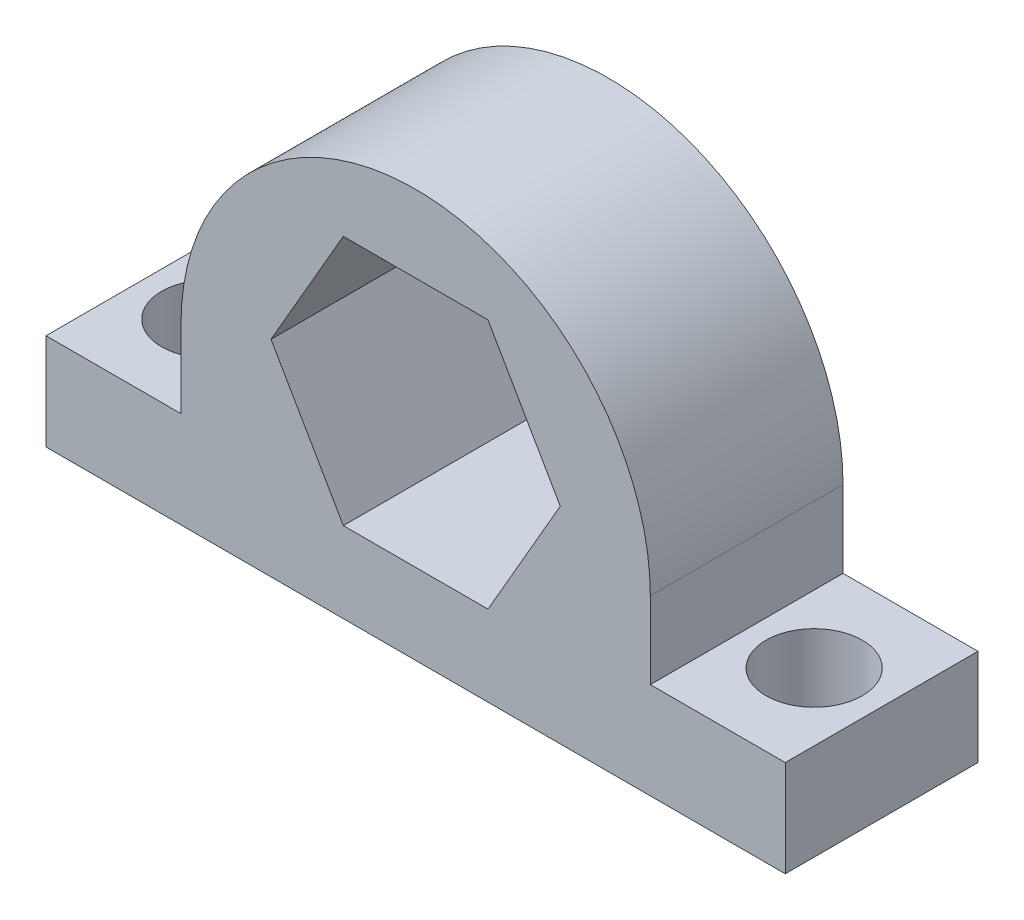
from build123d import *

# Parameters (mm, degrees)
BOSS_EXTRUDE1_DEPTH = 10
SKETCH2_R           = 2.5
CUT_EXTRUDE1_DEPTH  = 10


with BuildPart() as part:
    # Sketch1 → Boss-Extrude1 (new body)
    with BuildSketch(Plane.XY):
        with BuildLine():
            Line((-16, 0), (16, 0))
            Line((16, 0), (19.18, 0))
            Line((19.18, 0), (19.18, 5))
            Line((19.18, 5), (16, 5))
            Line((16, 5), (12.17699115, 5))
            Line((12.17699115, 5), (12.17699115, 8.995638399))
            ThreePointArc((12.17699115, 8.995638399), (0, 21.172629549), (-12.17699115, 8.995638399))
            Line((-12.17699115, 8.995638399), (-12.17699115, 5))
            Line((-12.17699115, 5), (-16, 5))
            Line((-16, 5), (-19.18, 5))
            Line((-19.18, 5), (-19.18, 0))
            Line((-19.18, 0), (-16, 0))
        make_face()
        Polygon((7.504424779, 10.68), (3.752212389, 17.179022499), (-3.752212389, 17.179022499), (-7.504424779, 10.68), (-3.752212389, 4.180977501), (3.752212389, 4.180977501), align=None, mode=Mode.SUBTRACT)
    extrude(amount=BOSS_EXTRUDE1_DEPTH)

    # Sketch2 → Cut-Extrude1 (cut)
    with BuildSketch(Plane(origin=(0, 5, 0), x_dir=(1, 0, 0), z_dir=(0, 1, 0))):
        with Locations((15.678495575, -5)):
            Circle(SKETCH2_R)
        with Locations((-15.678495575, -5)):
            Circle(SKETCH2_R)
    extrude(amount=-CUT_EXTRUDE1_DEPTH, mode=Mode.SUBTRACT)


solid = part.part
